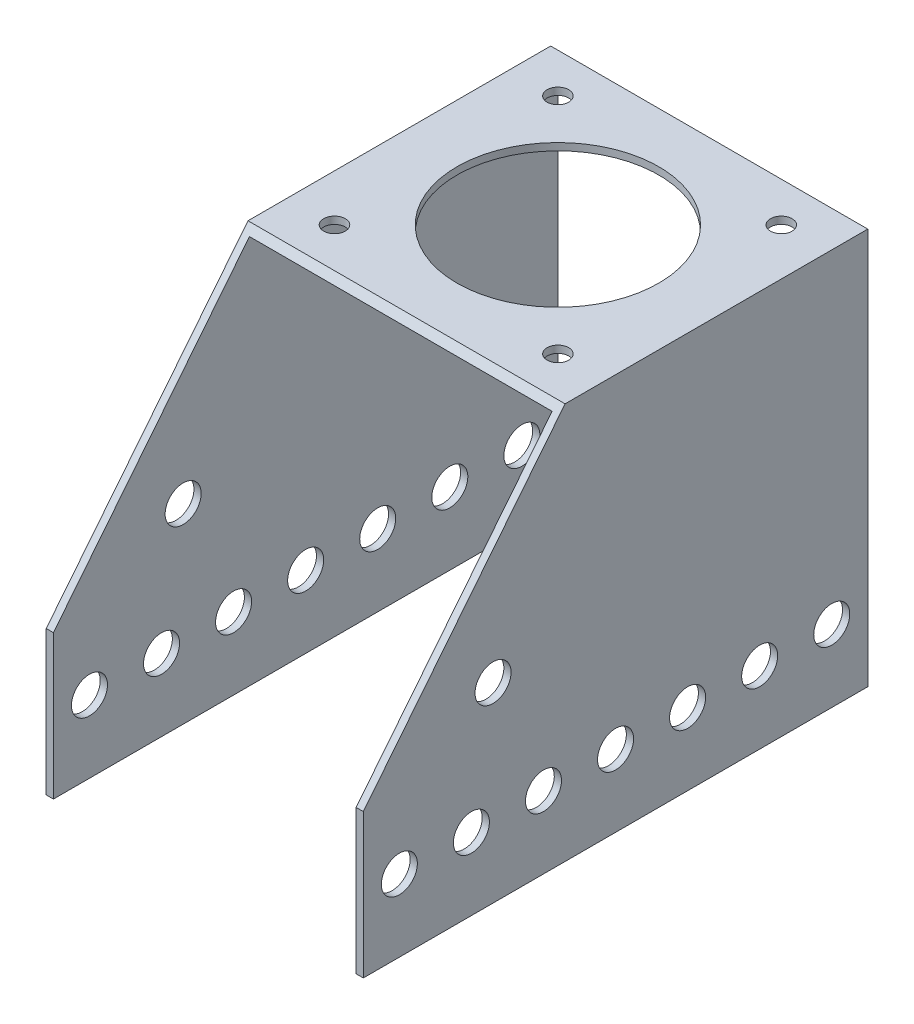
from build123d import *

# Parameters (mm, degrees)
BOSS_EXTRUDE1_DEPTH = 70
SKETCH2_R           = 1.5
SKETCH2_R_2         = 14
CUT_EXTRUDE1_DEPTH  = 92.70059978
SKETCH5_R           = 2.5
CUT_EXTRUDE3_DEPTH  = 88.133518235


with BuildPart() as part:
    # Sketch1 → Boss-Extrude1 (new body)
    with BuildSketch(Plane.XY):
        Polygon((-21, -27.5), (-21, 26.5), (21, 26.5), (21, -27.5), (22, -27.5), (22, 27.5), (-22, 27.5), (-22, -27.5), align=None)
    extrude(amount=BOSS_EXTRUDE1_DEPTH)

    # Sketch2 → Cut-Extrude1 (cut, through all)
    with BuildSketch(Plane(origin=(0, 27.5, 0), x_dir=(1, 0, 0), z_dir=(0, 1, 0))):
        with Locations((15.5, -36.5)):
            Circle(SKETCH2_R)
        with Locations((0, -21)):
            Circle(SKETCH2_R_2)
        with Locations((-15.5, -36.5)):
            Circle(SKETCH2_R)
        with Locations((-15.5, -5.5)):
            Circle(SKETCH2_R)
        with Locations((15.5, -5.5)):
            Circle(SKETCH2_R)
    extrude(amount=-CUT_EXTRUDE1_DEPTH, mode=Mode.SUBTRACT)

    # Sketch5 → Cut-Extrude3 (cut, through all)
    with BuildSketch(Plane.ZY.offset(22)):
        with Locations((5, -17.5)):
            Circle(SKETCH5_R)
        with Locations((15, -17.5)):
            Circle(SKETCH5_R)
        with Locations((25, -17.5)):
            Circle(SKETCH5_R)
        with Locations((35, -17.5)):
            Circle(SKETCH5_R)
        with Locations((45, -17.5)):
            Circle(SKETCH5_R)
        with Locations((55, -17.5)):
            Circle(SKETCH5_R)
        with Locations((65, -17.5)):
            Circle(SKETCH5_R)
        with Locations((52, -1.007810594)):
            Circle(SKETCH5_R)
        Polygon((70, -7.5), (42, 27.5), (70, 27.5), align=None)
    extrude(amount=-CUT_EXTRUDE3_DEPTH, mode=Mode.SUBTRACT)


solid = part.part
